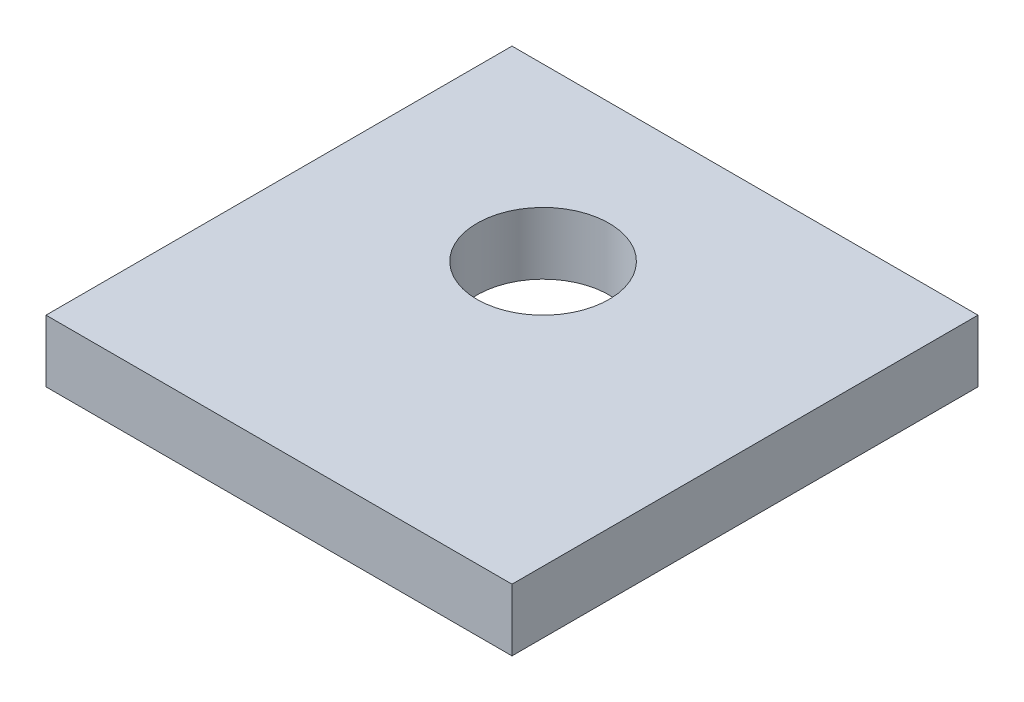
from build123d import *

# Parameters (mm, degrees)
SKETCH1_W           = 30
SKETCH1_H           = 30
BOSS_EXTRUDE1_DEPTH = 2
SKETCH2_R           = 4.25
CUT_EXTRUDE1_DEPTH  = 22.587033145


with BuildPart() as part:
    # Sketch1 → Boss-Extrude1 (new, symmetric)
    with BuildSketch(Plane(origin=(0, 0, 0), x_dir=(1, 0, 0), z_dir=(0, 1, 0))):
        Rectangle(SKETCH1_W, SKETCH1_H)
    extrude(amount=BOSS_EXTRUDE1_DEPTH, both=True)

    # Sketch2 → Cut-Extrude1 (cut, through all)
    with BuildSketch(Plane(origin=(0, 2, 0), x_dir=(1, 0, 0), z_dir=(0, 1, 0))):
        with Locations((-2, 4)):
            Circle(SKETCH2_R)
    extrude(amount=-CUT_EXTRUDE1_DEPTH, mode=Mode.SUBTRACT)


solid = part.part
